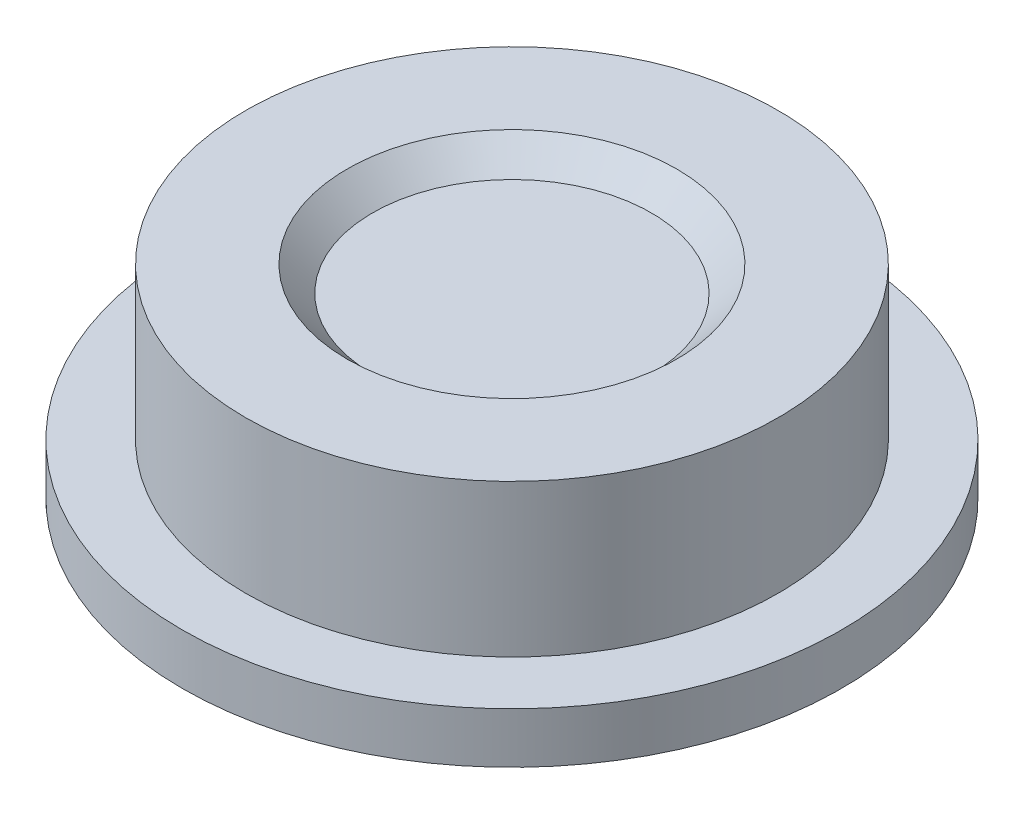
from build123d import *

# Parameters (mm, degrees)
BASES_R             = 6.5
BASE_DEPTH          = 1
O_RINGCAPTURES_R    = 5.25
O_RINGCAPTURE_DEPTH = 3
TOPBORES_R          = 3.25
TOPBORE_DEPTH       = 0.5
CHAMFER1_SIZE       = 0.5
CYLINDERBORES_R     = 1.5
CUT_EXTRUDE1_DEPTH  = 1.5
CUT_EXTRUDE1_DRAFT  = -40


with BuildPart() as part:
    # BaseS → Base (new body)
    with BuildSketch(Plane(origin=(0, 0, 0), x_dir=(1, 0, 0), z_dir=(0, 1, 0))):
        with Locations(Location((0, 0, 0), (0, 0, 270))):
            Circle(BASES_R)
    extrude(amount=-BASE_DEPTH)

    # O-RingCaptureS → O-RingCapture (add)
    with BuildSketch(Plane(origin=(0, 0, 0), x_dir=(1, 0, 0), z_dir=(0, 1, 0))):
        with Locations(Location((0, 0, 0), (0, 0, 270))):
            Circle(O_RINGCAPTURES_R)
    extrude(amount=O_RINGCAPTURE_DEPTH)

    # TopBoreS → TopBore (cut)
    with BuildSketch(Plane(origin=(0, 3, 0), x_dir=(1, 0, 0), z_dir=(0, 1, 0))):
        with Locations(Location((0, 0, 0), (0, 0, 270))):
            Circle(TOPBORES_R)
    extrude(amount=-TOPBORE_DEPTH, mode=Mode.SUBTRACT)

    # Chamfer1
    chamfer1_edges = [part.edges().sort_by_distance(p)[0] for p in [
        (0, 2.5, -3.25),
    ]]
    chamfer(chamfer1_edges, length=CHAMFER1_SIZE - 0.0001)  # a hair under: the kernel refuses the full size


with BuildPart() as cut_extrude1_tool:
    # CylinderBoreS → Cut-Extrude1 (with draft: the straight prism first)
    with BuildSketch(Plane(origin=(0, -1, 0), x_dir=(-1, 0, 0), z_dir=(0, -1, 0))):
        Circle(CYLINDERBORES_R)
    extrude(amount=-CUT_EXTRUDE1_DEPTH)
    # Cut-Extrude1: the draft: its side faces are tilted about the plane it starts from
    cut_extrude1_sides = [cut_extrude1_tool.faces().sort_by_distance(p)[0] for p in [
        (1.5, -0.25, 0),
    ]]
    draft(cut_extrude1_sides, Plane(origin=(0, -1, 0), x_dir=(-1, 0, 0), z_dir=(0, -1, 0)), CUT_EXTRUDE1_DRAFT)


with BuildPart() as part_1:
    add(part.part)

    # Cut-Extrude1: cut by cut_extrude1_tool
    add(cut_extrude1_tool.part, mode=Mode.SUBTRACT)


solid = part_1.part
